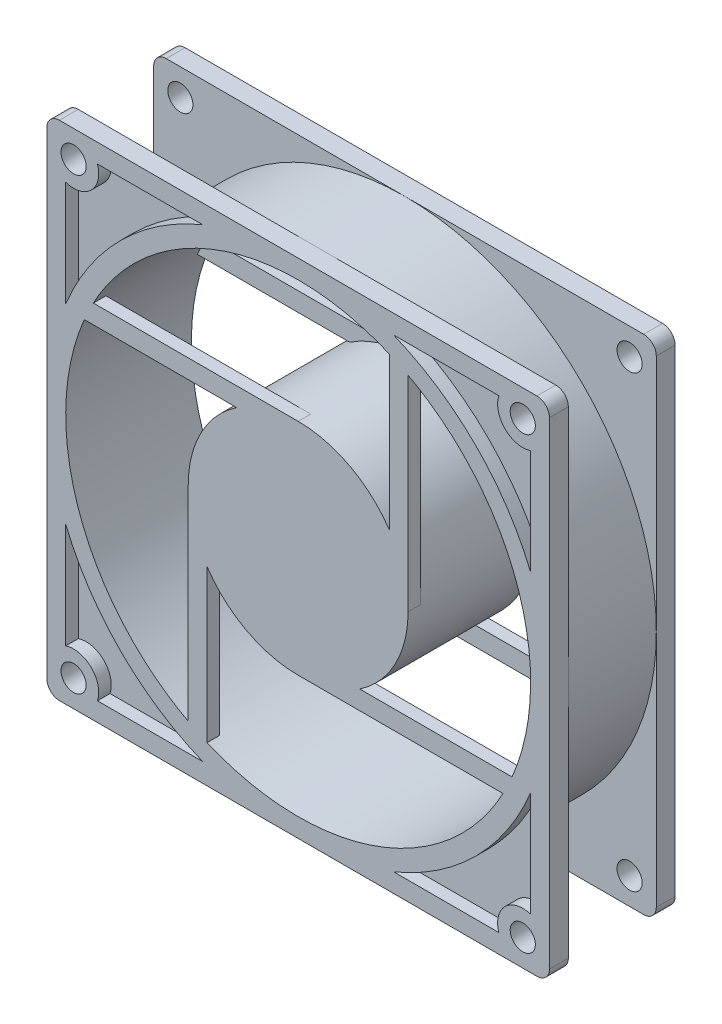
from build123d import *

# Parameters (mm, degrees)
SZKIC1_W                     = 80
SZKIC1_H                     = 80
DODANIE_WYCI_GNI_CIE1_DEPTH  = 10
ZAOKR_GLENIE1_R              = 2
SZKIC1_3_OUTSIDE_W           = 104.716
SZKIC1_3_OUTSIDE_H           = 104.716
SZKIC1_3_OUTSIDE_R           = 40
WYTNIJ_WYCI_GNI_CIE1_DEPTH   = 7
OTW_R_WENTYLACYJNY1_DEPTH    = 10
OTW_R_WENTYLACYJNY1_2_DEPTH  = 8
ZAAWANSOWANYOTW_R1_START     = 7
ZAAWANSOWANYOTW_R1_OUTLINE_R = 2
ZAAWANSOWANYOTW_R1_DEPTH     = 3
WYTNIJ_WYCI_GNI_CIE3_START   = -2
WYTNIJ_WYCI_GNI_CIE3_DEPTH   = 2


# Read off the part's stored shape, not the designer's step: Otwór wentylacyjny1, ZaawansowanyOtwór1
with BuildPart() as part:
    # Szkic1 → Dodanie-wyciągnięcie1 (new body)
    with BuildSketch(Plane.XY):
        Rectangle(SZKIC1_W, SZKIC1_H)
    extrude(amount=DODANIE_WYCI_GNI_CIE1_DEPTH)

    # Zaokrąglenie1
    zaokr_glenie1_edges = [part.edges().sort_by_distance(p)[0] for p in [
        (-40, -40, 5),
        (40, -40, 5),
        (40, 40, 5),
        (-40, 40, 5),
    ]]
    fillet(zaokr_glenie1_edges, radius=ZAOKR_GLENIE1_R)

    # Szkic1<3> outside → Wytnij-wyciągnięcie1 (cut, symmetric)
    with BuildSketch(Plane.XY):
        Rectangle(SZKIC1_3_OUTSIDE_W, SZKIC1_3_OUTSIDE_H)
        with Locations(Location((0, 0, 0), (0, 0, 180))):
            Circle(SZKIC1_3_OUTSIDE_R, mode=Mode.SUBTRACT)
    extrude(amount=WYTNIJ_WYCI_GNI_CIE1_DEPTH, both=True, mode=Mode.SUBTRACT)

    # Otwór wentylacyjny1 outline → Otwór wentylacyjny1 (cut)
    with BuildSketch(Plane.XY):
        with BuildLine():
            add(Edge.make_bspline(
                [(34.040429336, -14.499999957), (34.088697265, -14.38666683), (34.605289672, -13.156798718), (35.464511799, -10.758138884), (36.346946455, -7.229997853), (36.88190467, -3.632597533), (37.059056262, -9.1487e-05), (36.881870284, 3.632500172), (36.347007321, 7.22972858), (35.464562643, 10.75796062), (34.23817435, 14.181717048), (32.684348386, 17.47004286), (30.813581317, 20.588755659), (28.648091608, 23.510760972), (26.204839994, 26.204579984), (23.510904639, 28.647973712), (20.606665415, 30.800330507), (18.547447063, 32.038042381), (17.499999929, 32.600335346)],
                knots=[0.935910412, 0.935910412, 0.935910412, 0.935910412, 0.937499994, 0.953123807, 0.968749994, 0.984374403, 1, 1.015624403, 1.031249994, 1.046873807, 1.062499994, 1.078123807, 1.093749994, 1.109373807, 1.124999994, 1.140623807, 1.156249994, 1.171591393, 1.171591393, 1.171591393, 1.171591393], degree=3))
            Line((17.499999929, 32.600335346), (17.5, 0))
            add(Edge.make_bspline(
                [(9.797957677, -14.5), (10.721847377, -13.875687268), (12.473459044, -12.430591356), (14.644514965, -9.785152062), (16.272113183, -6.740129969), (17.274383217, -3.436088461), (17.5, -1.14536282), (17.5, 0)],
                knots=[0.844577031, 0.844577031, 0.844577031, 0.844577031, 0.875, 0.90625, 0.9375, 0.96875, 1, 1, 1, 1], degree=3))
            Line((9.797957677, -14.5), (34.040429336, -14.499999957))
        make_face()
        with BuildLine():
            Line((14.5, 9.797957677), (14.499999981, 34.04042939))
            add(Edge.make_bspline(
                [(14.499999981, 34.04042939), (14.386666846, 34.088697305), (13.156798701, 34.605289497), (10.758138677, 35.464510246), (7.230043541, 36.346941021), (3.632641335, 36.881878364), (0.000183853, 37.059056263), (-3.632456376, 36.881896581), (-7.229682899, 36.347012757), (-10.757960826, 35.464564196), (-14.181716993, 34.238173933), (-17.470042875, 32.684348498), (-20.588755655, 30.813581287), (-23.510760973, 28.648091616), (-26.204579984, 26.204839992), (-28.647973712, 23.51090464), (-30.800330507, 20.606665414), (-32.038042381, 18.547447063), (-32.600335346, 17.499999929)],
                knots=[0.185910412, 0.185910412, 0.185910412, 0.185910412, 0.187499994, 0.203123807, 0.218749994, 0.234373807, 0.249999994, 0.265623807, 0.281249994, 0.296873807, 0.312499994, 0.328123807, 0.343749994, 0.359373807, 0.374999994, 0.390623807, 0.406249994, 0.421591393, 0.421591393, 0.421591393, 0.421591393], degree=3))
            Line((-32.600335346, 17.499999929), (0, 17.5))
            add(Edge.make_bspline(
                [(14.5, 9.797957677), (13.875687268, 10.721847377), (12.430591356, 12.473459044), (9.785152062, 14.644514965), (6.740129969, 16.272113183), (3.436088461, 17.274383217), (1.14536282, 17.5), (0, 17.5)],
                knots=[0.094577031, 0.094577031, 0.094577031, 0.094577031, 0.125, 0.15625, 0.1875, 0.21875, 0.25, 0.25, 0.25, 0.25], degree=3))
        make_face()
        with BuildLine():
            add(Edge.make_bspline(
                [(-14.499999981, -34.04042939), (-14.386666846, -34.088697305), (-13.1567987, -34.605289497), (-10.758138677, -35.464510246), (-7.230043541, -36.346941021), (-3.632641335, -36.881878364), (-0.000183853, -37.059056263), (3.632456376, -36.881896581), (7.229682899, -36.347012757), (10.757960826, -35.464564196), (14.181716993, -34.238173933), (17.470042875, -32.684348498), (20.588755655, -30.813581287), (23.510760973, -28.648091616), (26.204579982, -26.204839992), (28.64797372, -23.510904641), (30.800330477, -20.60666541), (32.038042443, -18.547447071), (32.600335349, -17.499999929)],
                knots=[0.685910412, 0.685910412, 0.685910412, 0.685910412, 0.687499994, 0.703123807, 0.718749994, 0.734373807, 0.749999994, 0.765623807, 0.781249994, 0.796873807, 0.812499994, 0.828123807, 0.843749994, 0.859373807, 0.874999994, 0.890623807, 0.906249994, 0.921591393, 0.921591393, 0.921591393, 0.921591393], degree=3))
            Line((32.600335349, -17.499999929), (0, -17.5))
            add(Edge.make_bspline(
                [(-14.5, -9.797957677), (-13.875687268, -10.721847377), (-12.430591356, -12.473459044), (-9.785152062, -14.644514965), (-6.740129969, -16.272113183), (-3.436088461, -17.274383217), (-1.14536282, -17.5), (0, -17.5)],
                knots=[0.594577031, 0.594577031, 0.594577031, 0.594577031, 0.625, 0.65625, 0.6875, 0.71875, 0.75, 0.75, 0.75, 0.75], degree=3))
            Line((-14.5, -9.797957677), (-14.499999981, -34.04042939))
        make_face()
        with BuildLine():
            Line((-9.797957677, 14.5), (-34.04042939, 14.499999981))
            add(Edge.make_bspline(
                [(-34.04042939, 14.499999981), (-34.088697305, 14.386666846), (-34.605289497, 13.156798701), (-35.464510246, 10.758138677), (-36.346941021, 7.230043541), (-36.881878364, 3.632641335), (-37.059056263, 0.000183853), (-36.881896581, -3.632456376), (-36.347012757, -7.229682899), (-35.464564196, -10.757960826), (-34.238173933, -14.181716993), (-32.684348498, -17.470042875), (-30.813581287, -20.588755655), (-28.648091616, -23.510760973), (-26.204839992, -26.204579984), (-23.51090464, -28.647973712), (-20.60666534, -30.800330562), (-18.547446904, -32.038042477), (-17.499999683, -32.600335478)],
                knots=[0.435910412, 0.435910412, 0.435910412, 0.435910412, 0.437499994, 0.453123807, 0.468749994, 0.484373807, 0.499999994, 0.515623807, 0.531249994, 0.546873807, 0.562499994, 0.578123807, 0.593749994, 0.609373807, 0.624999994, 0.640623807, 0.656249994, 0.671591394, 0.671591394, 0.671591394, 0.671591394], degree=3))
            Line((-17.499999683, -32.600335478), (-17.5, 0))
            add(Edge.make_bspline(
                [(-9.797957677, 14.5), (-10.721847377, 13.875687268), (-12.473459044, 12.430591356), (-14.644514965, 9.785152062), (-16.272113183, 6.740129969), (-17.274383217, 3.436088461), (-17.5, 1.14536282), (-17.5, 0)],
                knots=[0.344577031, 0.344577031, 0.344577031, 0.344577031, 0.375, 0.40625, 0.4375, 0.46875, 0.5, 0.5, 0.5, 0.5], degree=3))
        make_face()
    extrude(amount=OTW_R_WENTYLACYJNY1_DEPTH, mode=Mode.SUBTRACT)

    # Otw_r wentylacyjny1 2 outline → Otw_r wentylacyjny1 2 (cut)
    with BuildSketch(Plane.XY):
        with BuildLine():
            Line((17.5, 0), (17.499999929, 32.600335346))
            add(Edge.make_bspline(
                [(17.499999929, 32.600335346), (17.480717914, 32.610686361), (16.502605474, 33.134632985), (15.500774012, 33.614205622), (14.499999981, 34.04042939)],
                knots=[0.171591393, 0.171591393, 0.171591393, 0.171591393, 0.171873807, 0.185910412, 0.185910412, 0.185910412, 0.185910412], degree=3))
            Line((14.499999981, 34.04042939), (14.5, 9.797957677))
            add(Edge.make_bspline(
                [(17.5, 0), (17.5, 1.14536282), (17.274383217, 3.436088461), (16.272113183, 6.740129969), (15.172689572, 8.797006873), (14.516971593, 9.772842251), (14.5, 9.797957677)],
                knots=[0, 0, 0, 0, 0.03125, 0.0625, 0.09375, 0.094577031, 0.094577031, 0.094577031, 0.094577031], degree=3))
        make_face()
        with BuildLine():
            add(Edge.make_bspline(
                [(32.600335349, -17.499999929), (32.610686364, -17.480717914), (33.134632932, -16.502605462), (33.614205421, -15.500773975), (34.040429336, -14.499999957)],
                knots=[0.921591393, 0.921591393, 0.921591393, 0.921591393, 0.921873807, 0.935910412, 0.935910412, 0.935910412, 0.935910412], degree=3))
            Line((34.040429336, -14.499999957), (9.797957677, -14.5))
            add(Edge.make_bspline(
                [(0, -17.5), (1.14536282, -17.5), (3.436088461, -17.274383217), (6.740129969, -16.272113183), (8.797006873, -15.172689572), (9.772842251, -14.516971593), (9.797957677, -14.5)],
                knots=[0.75, 0.75, 0.75, 0.75, 0.78125, 0.8125, 0.84375, 0.844577031, 0.844577031, 0.844577031, 0.844577031], degree=3))
            Line((0, -17.5), (32.600335349, -17.499999929))
        make_face()
        with BuildLine():
            Line((0, 17.5), (-32.600335346, 17.499999929))
            add(Edge.make_bspline(
                [(-32.600335346, 17.499999929), (-32.610686361, 17.480717914), (-33.134632985, 16.502605474), (-33.614205622, 15.500774012), (-34.04042939, 14.499999981)],
                knots=[0.421591393, 0.421591393, 0.421591393, 0.421591393, 0.421873807, 0.435910412, 0.435910412, 0.435910412, 0.435910412], degree=3))
            Line((-34.04042939, 14.499999981), (-9.797957677, 14.5))
            add(Edge.make_bspline(
                [(0, 17.5), (-1.14536282, 17.5), (-3.436088461, 17.274383217), (-6.740129969, 16.272113183), (-8.797006873, 15.172689572), (-9.772842251, 14.516971593), (-9.797957677, 14.5)],
                knots=[0.25, 0.25, 0.25, 0.25, 0.28125, 0.3125, 0.34375, 0.344577031, 0.344577031, 0.344577031, 0.344577031], degree=3))
        make_face()
        with BuildLine():
            add(Edge.make_bspline(
                [(-17.499999683, -32.600335478), (-17.48071775, -32.610686449), (-16.50260539, -33.134633025), (-15.500774012, -33.614205622), (-14.499999981, -34.04042939)],
                knots=[0.671591394, 0.671591394, 0.671591394, 0.671591394, 0.671873807, 0.685910412, 0.685910412, 0.685910412, 0.685910412], degree=3))
            Line((-14.499999981, -34.04042939), (-14.5, -9.797957677))
            add(Edge.make_bspline(
                [(-17.5, 0), (-17.5, -1.14536282), (-17.274383217, -3.436088461), (-16.272113183, -6.740129969), (-15.172689572, -8.797006873), (-14.516971593, -9.772842251), (-14.5, -9.797957677)],
                knots=[0.5, 0.5, 0.5, 0.5, 0.53125, 0.5625, 0.59375, 0.594577031, 0.594577031, 0.594577031, 0.594577031], degree=3))
            Line((-17.5, 0), (-17.499999683, -32.600335478))
        make_face()
    extrude(amount=OTW_R_WENTYLACYJNY1_2_DEPTH, mode=Mode.SUBTRACT)

    # ZaawansowanyOtwór1 outline → ZaawansowanyOtwór1 (cut)
    with BuildSketch(Plane.XY.offset(ZAAWANSOWANYOTW_R1_START)):
        with Locations((35.75, 35.75)):
            Circle(ZAAWANSOWANYOTW_R1_OUTLINE_R)
        with Locations((35.75, -35.75)):
            Circle(ZAAWANSOWANYOTW_R1_OUTLINE_R)
        with Locations((-35.75, -35.75)):
            Circle(ZAAWANSOWANYOTW_R1_OUTLINE_R)
        with Locations((-35.75, 35.75)):
            Circle(ZAAWANSOWANYOTW_R1_OUTLINE_R)
    extrude(amount=ZAAWANSOWANYOTW_R1_DEPTH, mode=Mode.SUBTRACT)

    # Szkic9 → Wytnij-wyciągnięcie3 (cut)
    with BuildSketch(Plane.XY.offset(10).offset(WYTNIJ_WYCI_GNI_CIE3_START)):
        with BuildLine():
            Line((-37, 31.950328962), (-37, 15.198684154))
            ThreePointArc((-37, 15.198684154), (-28.284271247, 28.284271247), (-15.198684154, 37))
            Line((-15.198684154, 37), (-31.950328962, 37))
            ThreePointArc((-31.950328962, 37), (-31.800399757, 36.382975452), (-31.75, 35.75))
            ThreePointArc((-31.75, 35.75), (-33.40479212, 32.509629651), (-37, 31.950328962))
        make_face()
        with BuildLine():
            ThreePointArc((15.198684154, 37), (28.284271247, 28.284271247), (37, 15.198684154))
            Line((37, 15.198684154), (37, 31.950328962))
            ThreePointArc((37, 31.950328962), (32.921572875, 32.921572875), (31.950328962, 37))
            Line((31.950328962, 37), (15.198684154, 37))
        make_face()
        with BuildLine():
            ThreePointArc((37, -15.198684154), (28.284271247, -28.284271247), (15.198684154, -37))
            Line((15.198684154, -37), (31.950328962, -37))
            ThreePointArc((31.950328962, -37), (32.921572875, -32.921572875), (37, -31.950328962))
            Line((37, -31.950328962), (37, -15.198684154))
        make_face()
        with BuildLine():
            ThreePointArc((-31.75, -35.75), (-31.800399757, -36.382975452), (-31.950328962, -37))
            Line((-31.950328962, -37), (-15.198684154, -37))
            ThreePointArc((-15.198684154, -37), (-28.284271247, -28.284271247), (-37, -15.198684154))
            Line((-37, -15.198684154), (-37, -31.950328962))
            ThreePointArc((-37, -31.950328962), (-33.40479212, -32.509629651), (-31.75, -35.75))
        make_face()
    extrude(amount=WYTNIJ_WYCI_GNI_CIE3_DEPTH, mode=Mode.SUBTRACT)

    # Lustro1: part across face


with BuildPart() as part_1:
    add(part.part)
    add(part.part.mirror(Plane(origin=(0, -1.257e-06, 0), x_dir=(1, 0, 0), z_dir=(0, 0, -1))))


solid = part_1.part
